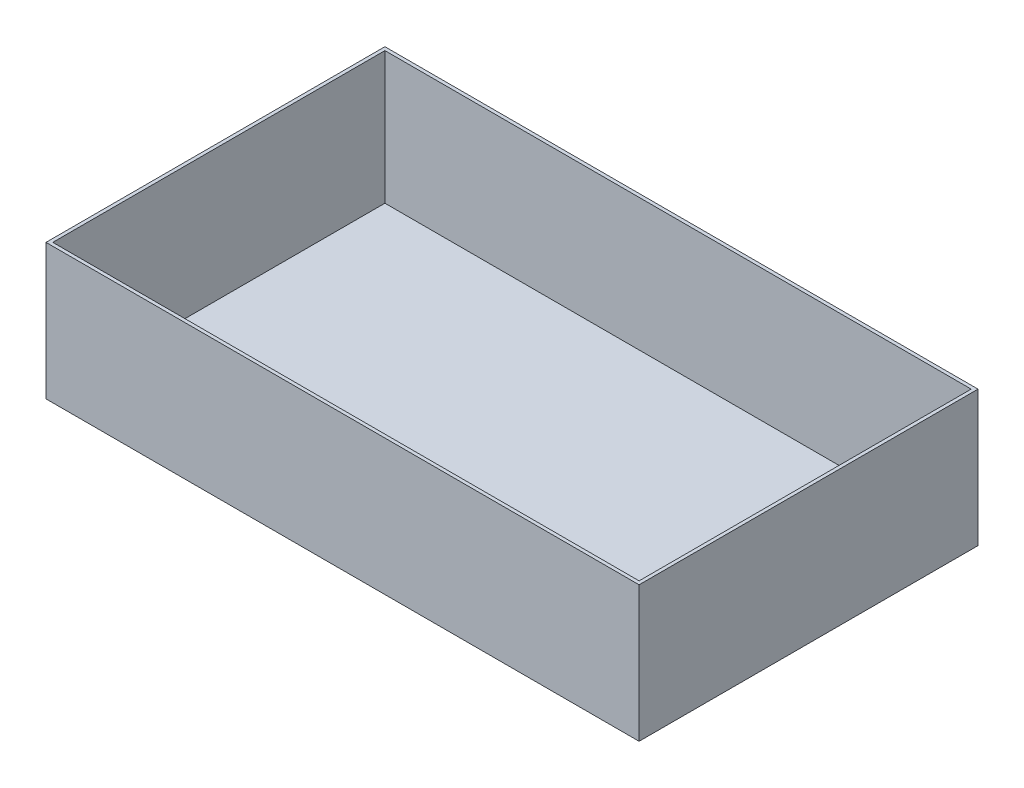
from build123d import *

# Parameters (mm, degrees)
SKETCH1_W           = 350
SKETCH1_H           = 200
BOSS_EXTRUDE1_DEPTH = 80
SHELL1_T            = -2


with BuildPart() as part:
    # Sketch1 → Boss-Extrude1 (new body)
    with BuildSketch(Plane(origin=(0, 0, 0), x_dir=(1, 0, 0), z_dir=(0, 1, 0))):
        Rectangle(SKETCH1_W, SKETCH1_H)
    extrude(amount=BOSS_EXTRUDE1_DEPTH)

    # Shell1
    shell1_openings = [part.faces().sort_by_distance(p)[0] for p in [
        (0, 80, 0),
    ]]
    offset(amount=SHELL1_T, openings=shell1_openings, kind=Kind.INTERSECTION)


solid = part.part
